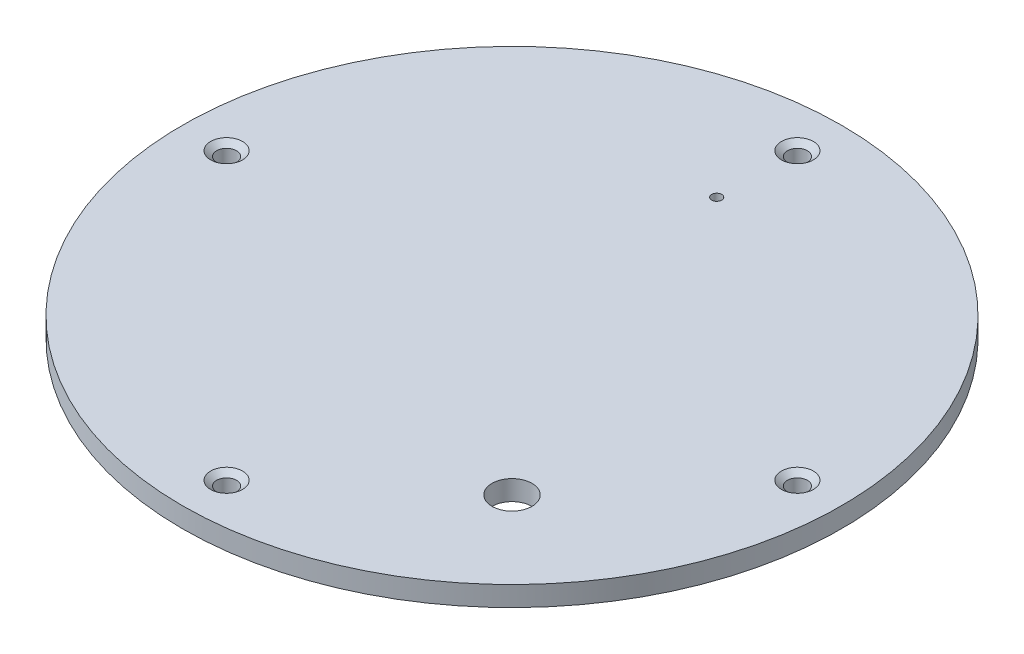
from build123d import *

# Parameters (mm, degrees)
SKETCH1_R                                       = 16.5
BOSS_EXTRUDE1_DEPTH                             = 1
CSK_FOR_M2_FLAT_HEAD_MACHINE_SCREW1_D           = 1
CSK_FOR_M2_FLAT_HEAD_MACHINE_SCREW1_CSINK_D     = 1.6
CSK_FOR_M2_FLAT_HEAD_MACHINE_SCREW1_CSINK_ANGLE = 100
CUT_EXTRUDE1_DEPTH                              = 24.355941428
CUT_EXTRUDE1_DEPTH_BACK                         = 24.355941428
SKETCH4_R                                       = 0.25
CUT_EXTRUDE2_DEPTH                              = 24.355941428
CUT_EXTRUDE2_DEPTH_BACK                         = 24.355941428
SKETCH5_R                                       = 1


with BuildPart() as part:
    # Sketch1 → Boss-Extrude1 (new body)
    with BuildSketch(Plane(origin=(0, 0, 0), x_dir=(1, 0, 0), z_dir=(0, 1, 0))):
        Circle(SKETCH1_R)
    extrude(amount=BOSS_EXTRUDE1_DEPTH)

    # CSK for M2 Flat Head Machine Screw1 (through all)
    with Locations(Plane(origin=(0, 1, 0), x_dir=(1, 0, 0), z_dir=(0, 1, 0))):
        with Locations((0, 14.29), (14.29, 0), (0, -14.29), (-14.29, 0)):
            CounterSinkHole(CSK_FOR_M2_FLAT_HEAD_MACHINE_SCREW1_D / 2, CSK_FOR_M2_FLAT_HEAD_MACHINE_SCREW1_CSINK_D / 2, counter_sink_angle=CSK_FOR_M2_FLAT_HEAD_MACHINE_SCREW1_CSINK_ANGLE)

    # Sketch4 → Cut-Extrude1 (cut, two sides: drawn at the far end of the back side and taken through both)
    with BuildSketch(Plane(origin=(0, 1, 0), x_dir=(1, 0, 0), z_dir=(0, 1, 0)).offset(-CUT_EXTRUDE1_DEPTH_BACK)):
        with Locations((0, 10.25)):
            Circle(SKETCH4_R)
    extrude(amount=CUT_EXTRUDE1_DEPTH + CUT_EXTRUDE1_DEPTH_BACK, mode=Mode.SUBTRACT)

    # Sketch5 → Cut-Extrude2 (cut, two sides: drawn at the far end of the back side and taken through both)
    with BuildSketch(Plane.XZ.offset(-CUT_EXTRUDE2_DEPTH_BACK)):
        with Locations((7.778174593, 7.778174593)):
            Circle(SKETCH5_R)
    extrude(amount=CUT_EXTRUDE2_DEPTH + CUT_EXTRUDE2_DEPTH_BACK, mode=Mode.SUBTRACT)


solid = part.part
